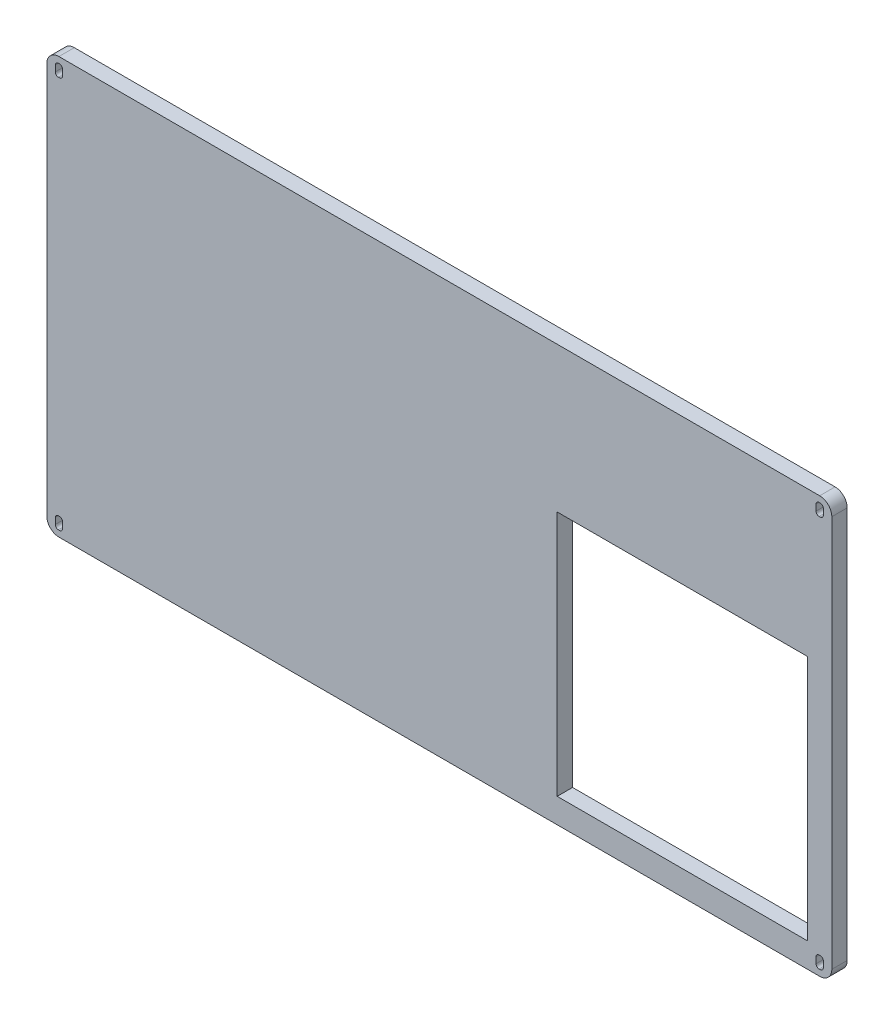
from build123d import *

# Parameters (mm, degrees)
SKETCH1_W           = 647.7
SKETCH1_H           = 343.408
SKETCH1_W_2         = 206.587092864
SKETCH1_H_2         = 203.2
BOSS_EXTRUDE1_DEPTH = 12.7
FILLET1_R           = 10


with BuildPart() as part:
    # Sketch1 → Boss-Extrude1 (new body)
    with BuildSketch(Plane.XY):
        with Locations((-66.978068182, 49.838840909)):
            Rectangle(SKETCH1_W, SKETCH1_H)
        with BuildLine():
            Line((247.371931818, -116.865159091), (246.371931818, -116.865159091))
            ThreePointArc((246.371931818, -116.865159091), (244.604164865, -116.132926044), (243.871931818, -114.365159091))
            Line((243.871931818, -114.365159091), (243.871931818, -109.365159091))
            ThreePointArc((243.871931818, -109.365159091), (244.604164865, -107.597392138), (246.371931818, -106.865159091))
            Line((246.371931818, -106.865159091), (247.371931818, -106.865159091))
            ThreePointArc((247.371931818, -106.865159091), (249.139698771, -107.597392138), (249.871931818, -109.365159091))
            Line((249.871931818, -109.365159091), (249.871931818, -114.365159091))
            ThreePointArc((249.871931818, -114.365159091), (249.139698771, -116.132926044), (247.371931818, -116.865159091))
        make_face(mode=Mode.SUBTRACT)
        with Locations((133.578385386, 0.072858907)):
            Rectangle(SKETCH1_W_2, SKETCH1_H_2, mode=Mode.SUBTRACT)
        with BuildLine():
            Line((-380.328068182, -116.865159091), (-381.328068182, -116.865159091))
            ThreePointArc((-381.328068182, -116.865159091), (-383.095835135, -116.132926044), (-383.828068182, -114.365159091))
            Line((-383.828068182, -114.365159091), (-383.828068182, -109.365159091))
            ThreePointArc((-383.828068182, -109.365159091), (-383.095835135, -107.597392138), (-381.328068182, -106.865159091))
            Line((-381.328068182, -106.865159091), (-380.328068182, -106.865159091))
            ThreePointArc((-380.328068182, -106.865159091), (-378.560301229, -107.597392138), (-377.828068182, -109.365159091))
            Line((-377.828068182, -109.365159091), (-377.828068182, -114.365159091))
            ThreePointArc((-377.828068182, -114.365159091), (-378.560301229, -116.132926044), (-380.328068182, -116.865159091))
        make_face(mode=Mode.SUBTRACT)
        with BuildLine():
            Line((-380.328068182, 206.544840909), (-381.328068182, 206.544840909))
            ThreePointArc((-381.328068182, 206.544840909), (-383.095835135, 207.277073956), (-383.828068182, 209.044840909))
            Line((-383.828068182, 209.044840909), (-383.828068182, 214.044840909))
            ThreePointArc((-383.828068182, 214.044840909), (-383.095835135, 215.812607862), (-381.328068182, 216.544840909))
            Line((-381.328068182, 216.544840909), (-380.328068182, 216.544840909))
            ThreePointArc((-380.328068182, 216.544840909), (-378.560301229, 215.812607862), (-377.828068182, 214.044840909))
            Line((-377.828068182, 214.044840909), (-377.828068182, 209.044840909))
            ThreePointArc((-377.828068182, 209.044840909), (-378.560301229, 207.277073956), (-380.328068182, 206.544840909))
        make_face(mode=Mode.SUBTRACT)
        with BuildLine():
            Line((247.371931818, 206.544840909), (246.371931818, 206.544840909))
            ThreePointArc((246.371931818, 206.544840909), (244.604164865, 207.277073956), (243.871931818, 209.044840909))
            Line((243.871931818, 209.044840909), (243.871931818, 214.044840909))
            ThreePointArc((243.871931818, 214.044840909), (244.604164865, 215.812607862), (246.371931818, 216.544840909))
            Line((246.371931818, 216.544840909), (247.371931818, 216.544840909))
            ThreePointArc((247.371931818, 216.544840909), (249.139698771, 215.812607862), (249.871931818, 214.044840909))
            Line((249.871931818, 214.044840909), (249.871931818, 209.044840909))
            ThreePointArc((249.871931818, 209.044840909), (249.139698771, 207.277073956), (247.371931818, 206.544840909))
        make_face(mode=Mode.SUBTRACT)
    extrude(amount=BOSS_EXTRUDE1_DEPTH)

    # Fillet1
    fillet1_edges = [part.edges().sort_by_distance(p)[0] for p in [
        (-390.828068182, -121.865159091, 6.35),
        (256.871931818, -121.865159091, 6.35),
        (256.871931818, 221.542840909, 6.35),
        (-390.828068182, 221.542840909, 6.35),
    ]]
    fillet(fillet1_edges, radius=FILLET1_R)


solid = part.part
